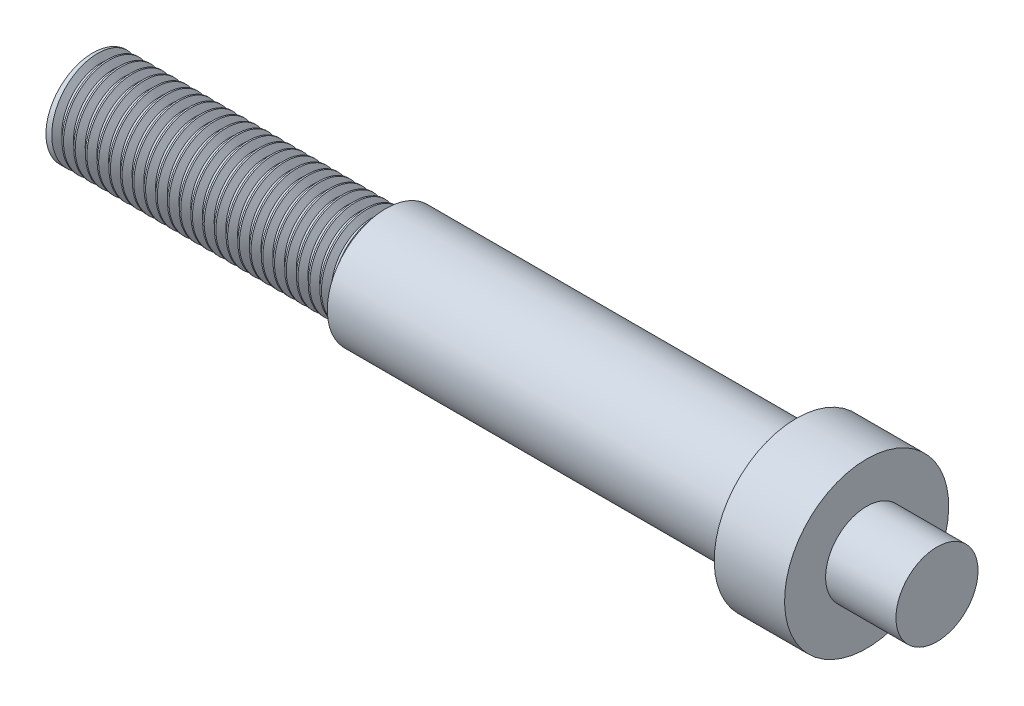
from build123d import *
from build123d.topology import SkipClean

# Parameters (mm, degrees)
THREAD1_PITCH = 1


with BuildPart() as part:
    # Sketch1 → Revolve1 (revolve)
    with BuildSketch(Plane.XY):
        Polygon((0, 0), (0, 4), (25, 4), (25, 5), (60, 5), (60, 7), (66, 7), (66, 3.5), (72, 3.5), (72, 0), align=None)
    revolve(axis=Axis((72, 0, 0), (-1, 0, 0)))

    # Thread1: the profile of Thread Profile1 profile screwed along a right-hand helix of 25 turns, 8 arcs to a turn; built about Z, then put on its axis
    with SkipClean():  # the faces are left unmerged after this step: merging them gives an invalid solid
        thread1_z = Axis((0, 0, 0), (0, 0, 1))
        thread1_corners = [(4.0003, 0, -0.000173205), (4.0003, 0, 0.875173202), (3.458734125, 0, 0.562499999), (3.458734125, 0, 0.312499999)]
        with BuildLine(mode=Mode.PRIVATE) as thread1_profile:
            Line(thread1_corners[0], thread1_corners[1])
            Line(thread1_corners[1], thread1_corners[2])
            Line(thread1_corners[2], thread1_corners[3])
            Line(thread1_corners[3], thread1_corners[0])
        thread1_cap = Face(thread1_profile.wire())
        thread1_turn_angles = [0, 22.5, 45, 67.5, 90, 112.5, 135, 157.5, 180, 202.5, 225, 247.5, 270, 292.5, 315, 337.5, 360]
        thread1_turn_weights = [1, 0.9238795325112867, 1, 0.9238795325112867, 1, 0.9238795325112867, 1, 0.9238795325112867, 1, 0.9238795325112867, 1, 0.9238795325112867, 1, 0.9238795325112867, 1, 0.9238795325112867, 1]
        thread1_turn_rails = [Edge.make_bspline([Vector(p[0], p[1], 0).rotate(thread1_z, thread1_turn_angles[k]) / thread1_turn_weights[k] + Vector(0, 0, p[2] + THREAD1_PITCH * thread1_turn_angles[k] / 360) for k in range(17)], [0, 0, 0, 1, 1, 2, 2, 3, 3, 4, 4, 5, 5, 6, 6, 7, 7, 8, 8, 8], 2, thread1_turn_weights) for p in thread1_corners]
        thread1_turn_sides = [Face.make_surface_from_curves(thread1_turn_rails[p[0]], thread1_turn_rails[p[1]]) for p in [(0, 1), (1, 2), (2, 3), (3, 0)]]
        thread1 = Plane(origin=(0, 0, 0), x_dir=(0, 0, -1), z_dir=(1, 0, 0)) * Solid(Shell([*[p.moved(Location((0, 0, THREAD1_PITCH * i))) for i in range(25) for p in thread1_turn_sides], thread1_cap, thread1_cap.rotate(thread1_z, 9000).moved(Location((0, 0, THREAD1_PITCH * 9000 / 360)))]))
        add(thread1, mode=Mode.SUBTRACT)


solid = part.part
